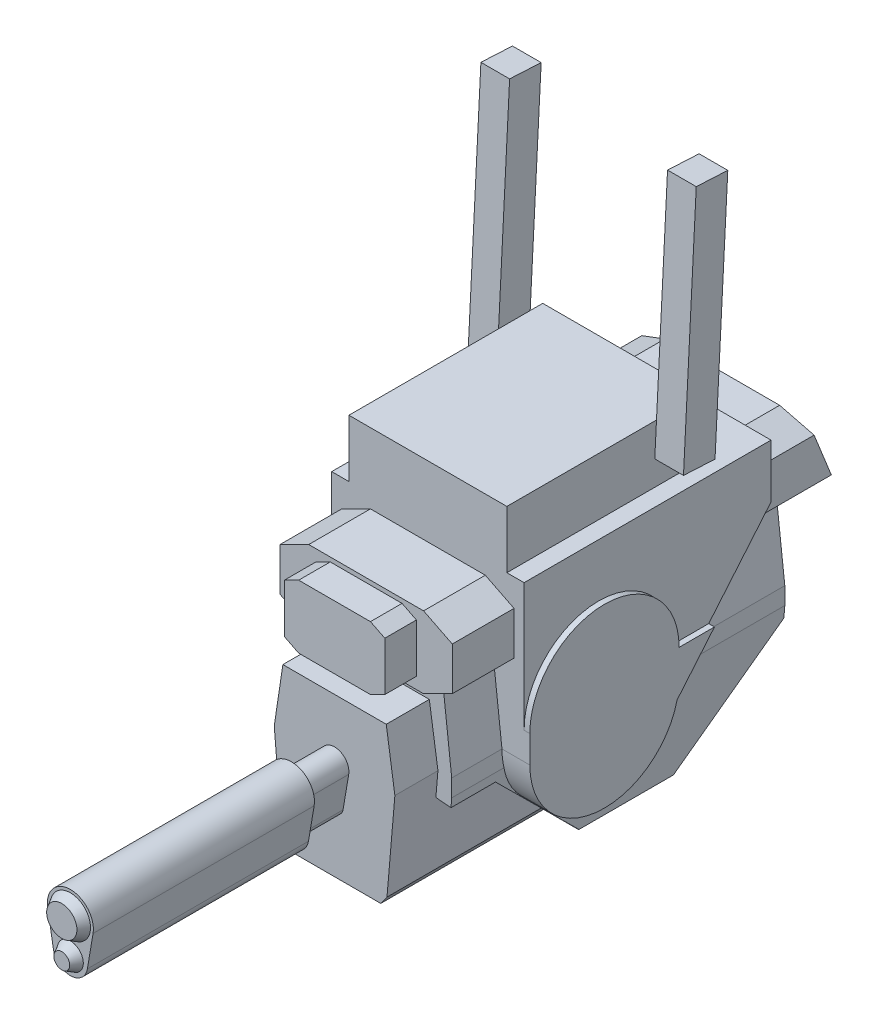
from build123d import *
from OCP.BRepFilletAPI import BRepFilletAPI_MakeChamfer

# Parameters (mm, degrees)
EXTRUDE_1_DEPTH     = 131
EXTRUDE_2_DEPTH     = 116
CUT_EXTRUDE_1_REACH = 148.45
CUT_EXTRUDE_2_REACH = 148.994
EXTRUDE_3_DEPTH     = 134
CUT_EXTRUDE_3_DEPTH = 67
EXTRUDE_4_DEPTH     = 11
EXTRUDE_START       = -33.5
EXTRUDE_5_DEPTH     = 67
EXTRUDE_6_DEPTH     = 2
EXTRUDE_7_DEPTH     = 20
EXTRUDE_8_DEPTH     = 10
EXTRUDE_9_DEPTH     = 10
CUT_EXTRUDE_4_REACH = 246.491
SKETCH_16_W         = 5.440253517
SKETCH_16_H         = 47
CUT_EXTRUDE_5_DEPTH = 219.790404517
EXTRUDE_10_DEPTH    = 15
CUT_EXTRUDE_6_DEPTH = 15
EXTRUDE_15_DEPTH    = 77
SKETCH_23_R         = 7
SKETCH_23_R_2       = 4.5
EXTRUDE_16_DEPTH    = 3
CHAMFER_1_SIZE      = 3
CHAMFER_1_SIZE_2    = 1.732050808
CHAMFER_2_SIZE      = 3
CHAMFER_2_SIZE2     = 1.907428497


# Read off the part's stored shape, not the designer's step: 凸台-拉伸5
with BuildPart() as part:
    # 草图1 → 凸台-拉伸1 (new body)
    with BuildSketch(Plane.XY):
        Polygon((0, 0), (3, 20), (39, 20), (42, 0), (39, -35), (3, -35), align=None)
    extrude(amount=-EXTRUDE_1_DEPTH)

    # 草图2 → 凸台-拉伸2 (add)
    with BuildSketch(Plane.XY.offset(-15)):
        Polygon((-2, 24.7), (-4.8, 0.2), (-4.8, -5.8), (-2, -40.3), (21, -40.3), (21, -35), (3, -35), (0, 0), (3, 20), (21, 20), (21, 24.7), align=None)
        Polygon((44, 24.7), (21, 24.7), (21, 20), (39, 20), (42, 0), (39, -35), (21, -35), (21, -40.3), (44, -40.3), (46.8, -5.8), (46.8, 0.2), align=None)
    extrude(amount=-EXTRUDE_2_DEPTH)

    # 切除-拉伸1: up to this plane
    cut_extrude_1_end = Plane(origin=(3, -35, -131), z_dir=(-0.996346649041751, -0.08540114134643588, 0))
    # 草图3 → 切除-拉伸1 (cut, up to the surface)
    with BuildSketch(Plane.ZY.offset(4.8), mode=Mode.PRIVATE) as cut_extrude_1_sk1:
        Polygon((-131, -40.3), (-131, -10.092413278), (-95, -40.3), align=None)
    cut_extrude_1_tool1 = split(extrude(cut_extrude_1_sk1.sketch, amount=-CUT_EXTRUDE_1_REACH, mode=Mode.PRIVATE), bisect_by=cut_extrude_1_end, keep=Keep.BOTH, mode=Mode.PRIVATE)
    add(cut_extrude_1_tool1.solids().sort_by_distance((-4.8, -30.230804, -119))[0], mode=Mode.SUBTRACT)
    # 草图3 → 切除-拉伸1 (cut, up to the surface)
    with BuildSketch(Plane.ZY.offset(4.8), mode=Mode.PRIVATE) as cut_extrude_1_sk2:
        Polygon((-62, -40.3), (-30.5, -8.8), (-15, -8.8), (-15, -40.3), align=None)
    cut_extrude_1_tool2 = split(extrude(cut_extrude_1_sk2.sketch, amount=-CUT_EXTRUDE_1_REACH, mode=Mode.PRIVATE), bisect_by=cut_extrude_1_end, keep=Keep.BOTH, mode=Mode.PRIVATE)
    add(cut_extrude_1_tool2.solids().sort_by_distance((-4.8, -27.196, -31.948))[0], mode=Mode.SUBTRACT)

    # 切除-拉伸2: up to this plane
    cut_extrude_2_end = Plane(origin=(42, 0, -131), z_dir=(0.996346649041751, -0.08540114134643569, 0))
    # 草图4 → 切除-拉伸2 (cut, up to the surface)
    with BuildSketch(Plane(origin=(46.8, 0, 0), x_dir=(0, 0, -1), z_dir=(1, 0, 0)), mode=Mode.PRIVATE) as cut_extrude_2_sk1:
        Polygon((15, -8.919073988), (15, -40.419073988), (62, -40.419073988), (30.5, -8.919073988), align=None)
    cut_extrude_2_tool1 = split(extrude(cut_extrude_2_sk1.sketch, amount=CUT_EXTRUDE_2_REACH, dir=(-0.996346649042, 0.085401141346, 0), mode=Mode.PRIVATE), bisect_by=cut_extrude_2_end, keep=Keep.BOTH, mode=Mode.PRIVATE)
    add(cut_extrude_2_tool1.solids().sort_by_distance((46.8, -27.315074, -31.948))[0], mode=Mode.SUBTRACT)

    # 草图6 → 凸台-拉伸3 (add)
    with BuildSketch(Plane.XY.offset(-11)):
        Polygon((-9, 29.7), (1, 24.7), (41, 24.7), (51, 29.7), (51, 44.7), (41, 49.7), (1, 49.7), (-9, 44.7), align=None)
    extrude(amount=-EXTRUDE_3_DEPTH)

    # 草图7 → 切除-拉伸3 (cut, symmetric)
    with BuildSketch(Plane.ZY.offset(4.8)):
        Polygon((-95, -40.3), (-131, -40.3), (-131, -9.728583388), align=None)
        Polygon((-145, 24.7), (-135, 49.7), (-145, 49.7), align=None)
    extrude(amount=CUT_EXTRUDE_3_DEPTH, both=True, mode=Mode.SUBTRACT)

    # 草图9 → 凸台-拉伸4 (add)
    with BuildSketch(Plane.XY.offset(-11)):
        Polygon((3.5, 45.7), (3.5, 28.7), (8.5, 26.2), (33.5, 26.2), (38.5, 28.7), (38.5, 45.7), (33.5, 48.2), (8.5, 48.2), align=None)
    extrude(amount=EXTRUDE_4_DEPTH)

    # 凸台-拉伸5 outline → 凸台-拉伸5 (add)
    with BuildSketch(Plane.ZY.offset(-21).offset(EXTRUDE_START)):
        with BuildLine():
            Line((-118.5, 35.555969457), (-83.798221281, -5.8))
            ThreePointArc((-83.798221281, -5.8), (-66.915700425, -24.400324924), (-42.17780049, -20.038226285))
            ThreePointArc((-42.17780049, -20.038226285), (-40.182635106, -18.251941452), (-38.381793618, -16.269905038))
            ThreePointArc((-38.381793618, -16.269905038), (-34.014561818, -8.544330565), (-32.5, 0.2))
            Line((-32.5, 0.2), (-32.5, 54.2))
            Line((-32.5, 54.2), (-118.5, 54.2))
            Line((-118.5, 54.2), (-118.5, 35.555969457))
        make_face()
    extrude(amount=EXTRUDE_5_DEPTH)

    # 草图11 → 凸台-拉伸6 (add)
    with BuildSketch(Plane.ZY.offset(12.5)):
        with BuildLine():
            Line((-84.5, 9.7), (-96.804265564, 9.7))
            Line((-96.804265564, 9.7), (-83.798221281, -5.8))
            ThreePointArc((-83.798221281, -5.8), (-66.915700425, -24.400324924), (-42.17780049, -20.038226285))
            ThreePointArc((-42.17780049, -20.038226285), (-40.182635106, -18.251941452), (-38.381793618, -16.269905038))
            ThreePointArc((-38.381793618, -16.269905038), (-34.014561818, -8.544330565), (-32.5, 0.2))
            Line((-32.5, 0.2), (-32.5, 9.7))
            ThreePointArc((-32.5, 9.7), (-58.5, 35.7), (-84.5, 9.7))
        make_face()
    extrude_6 = extrude(amount=EXTRUDE_6_DEPTH)

    # 镜向1: 凸台-拉伸6 across plane
    add(extrude_6.mirror(Plane.ZY.offset(-21)))

    # 草图12 → 凸台-拉伸7 (add)
    with BuildSketch(Plane(origin=(0, 54.2, 0), x_dir=(1, 0, 0), z_dir=(0, 1, 0))):
        Polygon((21, 100), (-6.5, 100), (-6.5, 32.5), (48.5, 32.5), (48.5, 100), align=None)
    extrude(amount=EXTRUDE_7_DEPTH)

    # 草图13 → 凸台-拉伸8 (add)
    with BuildSketch(Plane.ZY.offset(6.5)):
        Polygon((-95, 62.2), (-99.448556281, 147.083510454), (-88.463631398, 147.659205973), (-84.015075118, 62.775695519), align=None)
    extrude(amount=EXTRUDE_8_DEPTH)

    # 草图14 → 凸台-拉伸9 (add)
    with BuildSketch(Plane(origin=(48.5, 0, 0), x_dir=(0, 0, -1), z_dir=(1, 0, 0))):
        Polygon((84.613797545, 74.2), (95.628893351, 74.2), (99.448556281, 147.083510454), (88.463631398, 147.659205973), align=None)
        Polygon((84.015075118, 62.775695519), (95, 62.2), (95.628893351, 74.2), (84.613797545, 74.2), align=None)
    extrude(amount=EXTRUDE_9_DEPTH)

    # 切除-拉伸4: up to this plane
    cut_extrude_4_end = Plane(origin=(-16.436947072, -34.998764239, 0), z_dir=(-0.08540114134643567, -0.996346649041751, 0))
    # 草图16 → 切除-拉伸4 (cut, up to the surface)
    with BuildSketch(Plane.XZ.offset(40.3), mode=Mode.PRIVATE) as cut_extrude_4_sk1:
        with Locations((41.279873241, -38.5)):
            Rectangle(SKETCH_16_W, SKETCH_16_H)
    cut_extrude_4_tool1 = split(extrude(cut_extrude_4_sk1.sketch, amount=-CUT_EXTRUDE_4_REACH, mode=Mode.PRIVATE), bisect_by=cut_extrude_4_end, keep=Keep.BOTH, mode=Mode.PRIVATE)
    add(cut_extrude_4_tool1.solids().sort_by_distance((41.279873, -40.3, -38.5))[0], mode=Mode.SUBTRACT)

    # 草图17 → 切除-拉伸5 (cut, through all)
    with BuildSketch(Plane.ZY.offset(12.5)):
        Polygon((-15, -40.3), (-15, -35), (-56.7, -35), (-62, -40.3), align=None)
    extrude(amount=-CUT_EXTRUDE_5_DEPTH, mode=Mode.SUBTRACT)

    # 草图18 → 凸台-拉伸10 (add)
    with BuildSketch(Plane.XY):
        with BuildLine():
            Line((16.069933514, -1.66230637), (18.041960108, -13.328973037))
            ThreePointArc((18.041960108, -13.328973037), (21, -15.828973037), (23.958039892, -13.328973037))
            Line((23.958039892, -13.328973037), (25.930066486, -1.66230637))
            ThreePointArc((25.930066486, -1.66230637), (21, 4.171026963), (16.069933514, -1.66230637))
        make_face()
    extrude(amount=EXTRUDE_10_DEPTH)

    # 草图20 → 切除-拉伸6 (cut)
    with BuildSketch(Plane.XY.offset(15)):
        with BuildLine():
            Line((17.055946811, -1.495639704), (19.027973406, -13.16230637))
            ThreePointArc((19.027973406, -13.16230637), (21, -14.828973037), (22.972026594, -13.16230637))
            Line((22.972026594, -13.16230637), (24.944053189, -1.495639704))
            ThreePointArc((24.944053189, -1.495639704), (21, 3.171026963), (17.055946811, -1.495639704))
        make_face()
    extrude(amount=-CUT_EXTRUDE_6_DEPTH, mode=Mode.SUBTRACT)

    # 草图21 → 凸台-拉伸15 (add)
    with BuildSketch(Plane.XY.offset(15)):
        with BuildLine():
            Line((13.111893623, -2.16230637), (15.083920217, -13.828973037))
            ThreePointArc((15.083920217, -13.828973037), (21, -18.828973037), (26.916079783, -13.828973037))
            Line((26.916079783, -13.828973037), (28.888106377, -2.16230637))
            ThreePointArc((28.888106377, -2.16230637), (21, 7.171026963), (13.111893623, -2.16230637))
        make_face()
    extrude(amount=EXTRUDE_15_DEPTH)

    # 草图23 → 凸台-拉伸16 (add)
    with BuildSketch(Plane.XY.offset(92)):
        with Locations((21, -0.828973037)):
            Circle(SKETCH_23_R)
        with Locations((21, -12.828973037)):
            Circle(SKETCH_23_R_2)
    extrude(amount=EXTRUDE_16_DEPTH)

    # 倒角1
    chamfer_1_edges_1 = [part.edges().sort_by_distance(p)[0] for p in [
        (14, -0.828973037, 95),
    ]]
    chamfer_1_side_1 = [part.faces().sort_by_distance(p)[0] for p in [
        (14, -0.828973037, 94.965358984),
    ]]
    chamfer_1_edges_2 = [part.edges().sort_by_distance(p)[0] for p in [
        (16.5, -12.828973037, 95),
    ]]
    chamfer_1_side_2 = [part.faces().sort_by_distance(p)[0] for p in [
        (16.5, -12.828973037, 94.965358984),
    ]]
    chamfer_1 = BRepFilletAPI_MakeChamfer(part.part.solid().wrapped)
    for e in chamfer_1_edges_1:
        chamfer_1.Add(CHAMFER_1_SIZE - 0.0001, CHAMFER_1_SIZE_2 - 0.0001, e.wrapped, chamfer_1_side_1[0].wrapped)
    for e in chamfer_1_edges_2:
        chamfer_1.Add(CHAMFER_1_SIZE - 0.0001, CHAMFER_1_SIZE_2 - 0.0001, e.wrapped, chamfer_1_side_2[0].wrapped)
    add(Compound.cast(chamfer_1.Shape()), mode=Mode.REPLACE)  # a hair under: the kernel refuses the full size

    # 倒角2: one chamfer whose edges measure the first distance from different faces: ONE call of the kernel's chamfer builder (chamfer() names one face for all edges)
    chamfer_2_edges_1 = [part.edges().sort_by_distance(p)[0] for p in [
        (3, -35, -28.35),
    ]]
    chamfer_2_side_1 = [part.faces().sort_by_distance(p)[0] for p in [
        (21, -35, -28.35),
    ]]
    chamfer_2_edges_2 = [part.edges().sort_by_distance(p)[0] for p in [
        (39, -35, -28.35),
    ]]
    chamfer_2_side_2 = [part.faces().sort_by_distance(p)[0] for p in [
        (40.177893681, -21.257907057, -21.206076587),
    ]]
    chamfer_2 = BRepFilletAPI_MakeChamfer(part.part.solid().wrapped)
    for e in chamfer_2_edges_1:
        chamfer_2.Add(CHAMFER_2_SIZE, CHAMFER_2_SIZE2, e.wrapped, chamfer_2_side_1[0].wrapped)  # the first distance lies on this face
    for e in chamfer_2_edges_2:
        chamfer_2.Add(CHAMFER_2_SIZE, CHAMFER_2_SIZE2, e.wrapped, chamfer_2_side_2[0].wrapped)  # the first distance lies on this face
    add(Compound.cast(chamfer_2.Shape()), mode=Mode.REPLACE)


solid = part.part
